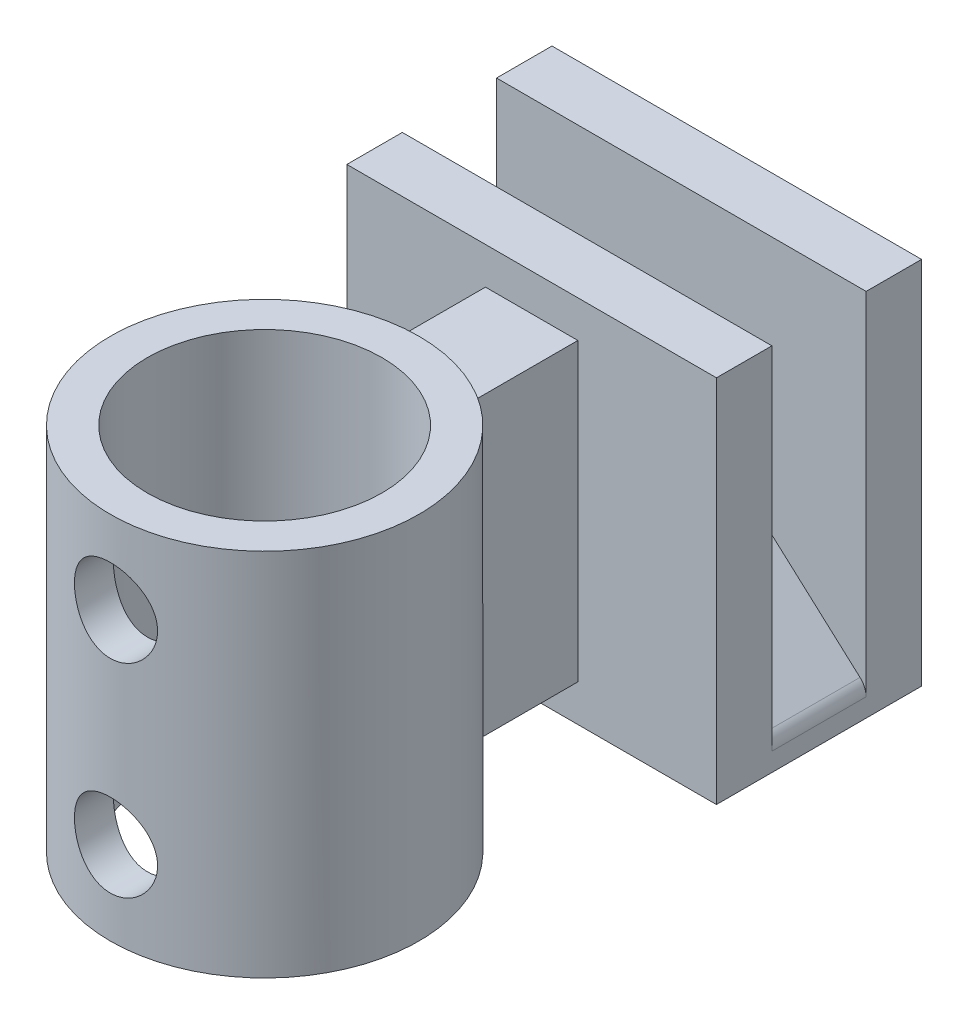
from build123d import *

# Parameters (mm, degrees)
SKETCH2_W                       = 20
SKETCH2_H                       = 10
BOSS_EXTRUDE1_DEPTH             = 2.55
CHAMFER1_SIZE                   = 9.5
CHAMFER1_SIZE2                  = 8.553838421
FILLET3_R                       = 1
SKETCH3_W                       = 20
SKETCH3_H                       = 20
BOSS_EXTRUDE2_DEPTH             = 3
BOSS_EXTRUDE3_REACH             = 20.863
SKETCH6_R                       = 8.35
SKETCH6_R_2                     = 6.35
BOSS_EXTRUDE3_DIRECTION_2_REACH = 20.863
BOSS_EXTRUDE4_REACH             = 31.066
BOSS_EXTRUDE4_END_RADIUS        = 8.35
SKETCH5_W                       = 5
SKETCH5_H                       = 16
CUT_EXTRUDE1_REACH              = 33.27
CUT_EXTRUDE1_END_RADIUS         = 8.35
SKETCH7_R                       = 2.25


with BuildPart() as part:
    # Sketch2 → Boss-Extrude1 (new, symmetric)
    with BuildSketch(Plane.XY):
        Rectangle(SKETCH2_W, SKETCH2_H)
    extrude(amount=BOSS_EXTRUDE1_DEPTH, both=True)

    # Chamfer1
    chamfer1_edges = [part.edges().sort_by_distance(p)[0] for p in [
        (10, 5, 0),
        (-10, 5, 0),
    ]]
    chamfer1_side = [part.faces().sort_by_distance(p)[0] for p in [
        (0, 5, 0),
    ]]
    chamfer(chamfer1_edges, length=CHAMFER1_SIZE, length2=CHAMFER1_SIZE2, reference=chamfer1_side[0])

    # Fillet3
    fillet3_edges = [part.edges().sort_by_distance(p)[0] for p in [
        (-10, -3.553838421, 0),
        (10, -3.553838421, 0),
        (0.5, 5, 0),
        (-0.5, 5, 0),
    ]]
    fillet(fillet3_edges, radius=FILLET3_R)

    # Sketch3 → Boss-Extrude2 (add)
    with BuildSketch(Plane.XY.offset(2.55)):
        with Locations((0, 5)):
            Rectangle(SKETCH3_W, SKETCH3_H)
    boss_extrude2 = extrude(amount=BOSS_EXTRUDE2_DEPTH)

    # Mirror1: Boss-Extrude2 across plane
    add(boss_extrude2.mirror(Plane.XY))


with BuildPart() as body_2:

    # Boss-Extrude3: up to this face of the body (flat: up to its plane)
    boss_extrude3_end = Plane(part.part.faces().sort_by_distance((0, 15, 4.05))[0])
    # Sketch6 → Boss-Extrude3 (new, up to the picked face)
    with BuildSketch(Plane(origin=(0, 0, 0), x_dir=(1, 0, 0), z_dir=(0, 1, 0)), mode=Mode.PRIVATE) as boss_extrude3_sk1:
        with Locations((0, -20)):
            Circle(SKETCH6_R)
        with Locations((0, -20)):
            Circle(SKETCH6_R_2, mode=Mode.SUBTRACT)
    boss_extrude3_tool1 = split(extrude(boss_extrude3_sk1.sketch, amount=BOSS_EXTRUDE3_REACH, mode=Mode.PRIVATE), bisect_by=boss_extrude3_end, keep=Keep.BOTH, mode=Mode.PRIVATE)
    add(boss_extrude3_tool1.solids().sort_by(Axis((-8.113826, 0, 20), (0, 1, 0)))[0])


    # Boss-Extrude3 direction 2: up to this face of the body (flat: up to its plane)
    boss_extrude3_direction_2_end = Plane(part.part.faces().sort_by_distance((0, -5, 0))[0])
    # Sketch6 → Boss-Extrude3 direction 2 (add, up to the picked face)
    with BuildSketch(Plane(origin=(0, 0, 0), x_dir=(1, 0, 0), z_dir=(0, 1, 0)), mode=Mode.PRIVATE) as boss_extrude3_direction_2_sk1:
        with Locations((0, -20)):
            Circle(SKETCH6_R)
        with Locations((0, -20)):
            Circle(SKETCH6_R_2, mode=Mode.SUBTRACT)
    boss_extrude3_direction_2_tool1 = split(extrude(boss_extrude3_direction_2_sk1.sketch, amount=-BOSS_EXTRUDE3_DIRECTION_2_REACH, mode=Mode.PRIVATE), bisect_by=boss_extrude3_direction_2_end, keep=Keep.BOTH, mode=Mode.PRIVATE)
    add(boss_extrude3_direction_2_tool1.solids().sort_by(Axis((-8.113826, 0, 20), (0, -1, 0)))[0])


with BuildPart() as part_1:
    add(part.part)

    add(body_2.part)  # Boss-Extrude4 merges body 2
    # Boss-Extrude4: up to this cylinder (the profile starts outside it)
    boss_extrude4_end = Plane(origin=(0, 5, 20), z_dir=(0, -1, 0)) * Cylinder(BOSS_EXTRUDE4_END_RADIUS, 79.832, mode=Mode.PRIVATE)
    # Sketch5 → Boss-Extrude4 (add, up to the surface)
    with BuildSketch(Plane.XY.offset(5.55), mode=Mode.PRIVATE) as boss_extrude4_sk1:
        with Locations((0, 5)):
            Rectangle(SKETCH5_W, SKETCH5_H)
    boss_extrude4_tool1 = extrude(boss_extrude4_sk1.sketch, amount=BOSS_EXTRUDE4_REACH, mode=Mode.PRIVATE) - boss_extrude4_end
    add(boss_extrude4_tool1.solids().sort_by_distance((0, 5, 5.55))[0])

    # Cut-Extrude1: up to this cylinder (the profile starts inside it)
    cut_extrude1_end = Plane(origin=(0, 5, 20), z_dir=(0, -1, 0)) * Cylinder(CUT_EXTRUDE1_END_RADIUS, 95.24, mode=Mode.PRIVATE)
    # Sketch7 → Cut-Extrude1 (cut, up to the surface)
    with BuildSketch(Plane.XY.offset(20), mode=Mode.PRIVATE) as cut_extrude1_sk1:
        with Locations((0, 10.5)):
            Circle(SKETCH7_R)
    cut_extrude1_tool1 = extrude(cut_extrude1_sk1.sketch, amount=CUT_EXTRUDE1_REACH, mode=Mode.PRIVATE) & cut_extrude1_end
    add(cut_extrude1_tool1.solids().sort_by_distance((0, 10.5, 20))[0], mode=Mode.SUBTRACT)
    # Sketch7 → Cut-Extrude1 (cut, up to the surface)
    with BuildSketch(Plane.XY.offset(20), mode=Mode.PRIVATE) as cut_extrude1_sk2:
        with Locations((0, -0.5)):
            Circle(SKETCH7_R)
    cut_extrude1_tool2 = extrude(cut_extrude1_sk2.sketch, amount=CUT_EXTRUDE1_REACH, mode=Mode.PRIVATE) & cut_extrude1_end
    add(cut_extrude1_tool2.solids().sort_by_distance((0, -0.5, 20))[0], mode=Mode.SUBTRACT)


solid = part_1.part
